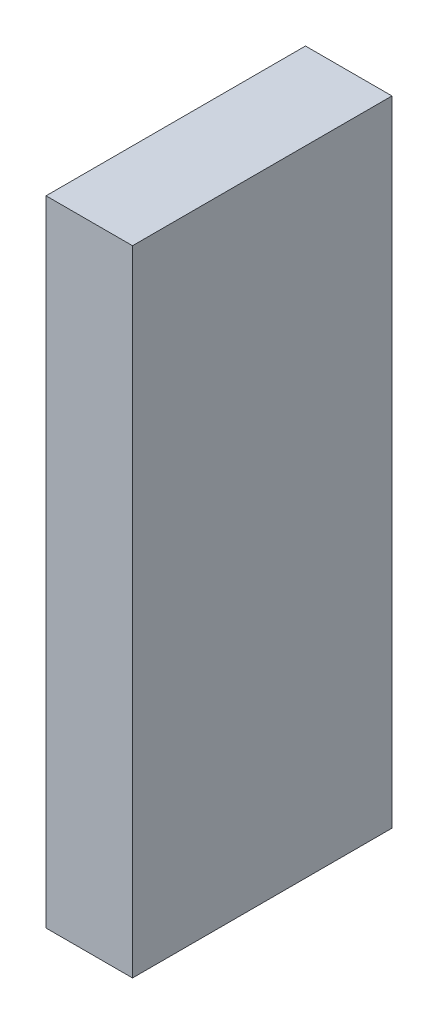
from build123d import *

# Parameters (mm, degrees)
SKETCH1_W           = 30
SKETCH1_H           = 90
BOSS_EXTRUDE1_DEPTH = 110


with BuildPart() as part:
    # Sketch1 → Boss-Extrude1 (new, symmetric)
    with BuildSketch(Plane(origin=(0, 0, 0), x_dir=(1, 0, 0), z_dir=(0, 1, 0))):
        Rectangle(SKETCH1_W, SKETCH1_H)
    extrude(amount=BOSS_EXTRUDE1_DEPTH, both=True)


solid = part.part
